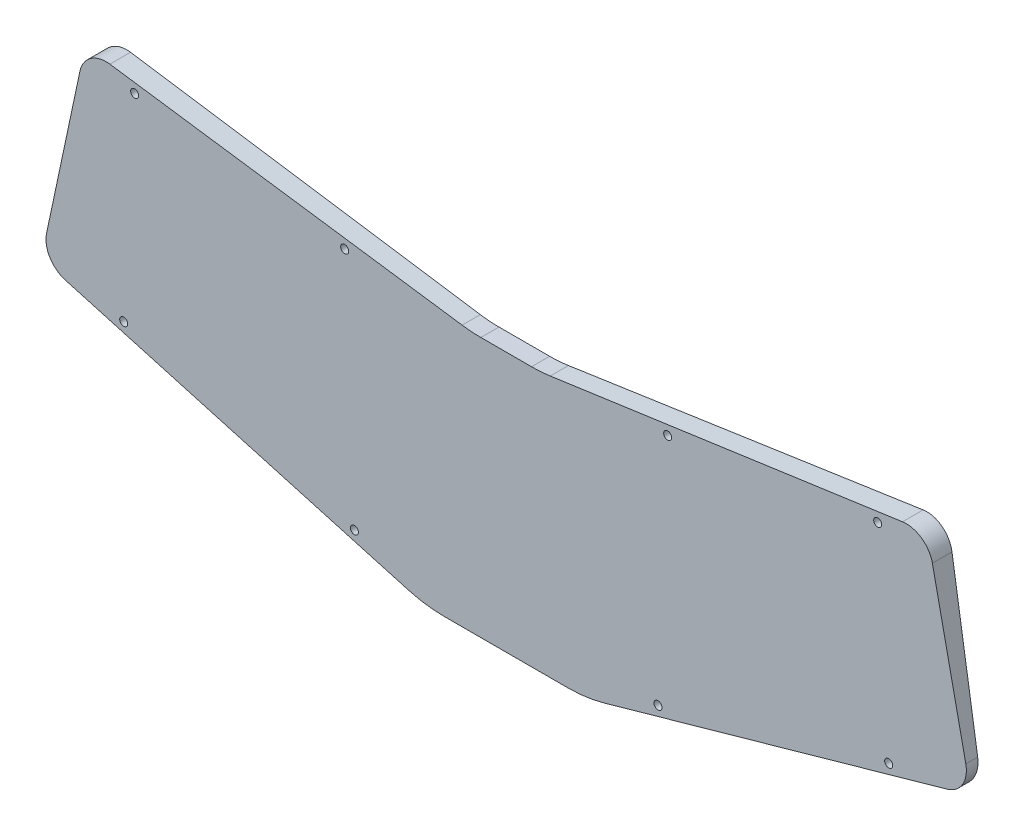
from build123d import *

# Parameters (mm, degrees)
MODEL_R                 = 1.5
BOSS_EXTRUDE1_DEPTH     = 8
MODEL_3_R               = 1.5
BOSS_EXTRUDE2_DEPTH     = 8
CUT_EXTRUDE2_DEPTH      = 341.706541914
CUT_EXTRUDE2_DEPTH_BACK = 341.706541914


with BuildPart() as part:
    # Model → Boss-Extrude1 (new body)
    with BuildSketch(Plane.XY):
        with BuildLine():
            Line((332.060338107, 8.179016053), (319.565261174, 66.96373151))
            ThreePointArc((319.565261174, 66.96373151), (315.515297863, 73.079110459), (308.381777137, 74.78584552))
            Line((308.381777137, 74.78584552), (176.614039179, 56.12761726))
            ThreePointArc((176.614039179, 56.12761726), (173.117705991, 55.75738597), (169.603999044, 55.6337718))
            Line((169.603999044, 55.6337718), (150.648829756, 55.6337718))
            ThreePointArc((150.648829756, 55.6337718), (147.135122809, 55.75738597), (143.63878962, 56.12761726))
            Line((143.63878962, 56.12761726), (11.871051663, 74.785845521))
            ThreePointArc((11.871051663, 74.785845521), (4.737530938, 73.07911046), (0.687567627, 66.963731511))
            Line((0.687567627, 66.963731511), (-11.807509307, 8.179016053))
            ThreePointArc((-11.807509307, 8.179016053), (-10.587273101, 0.932194341), (-4.743504981, -3.523787647))
            Line((-4.743504981, -3.523787647), (123.463014033, -39.725878608))
            ThreePointArc((123.463014033, -39.725878608), (130.191863147, -41.134819356), (137.050372447, -41.6074446))
            Line((137.050372447, -41.6074446), (183.202456353, -41.6074446))
            ThreePointArc((183.202456353, -41.6074446), (190.060965653, -41.134819356), (196.789814767, -39.725878608))
            Line((196.789814767, -39.725878608), (324.996333781, -3.523787647))
            ThreePointArc((324.996333781, -3.523787647), (330.840101901, 0.932194341), (332.060338107, 8.179016053))
        make_face()
        with Locations((103.335575354, -30.405568574)):
            Circle(MODEL_R, mode=Mode.SUBTRACT)
        with Locations((17.039281052, -6.037803815)):
            Circle(MODEL_R, mode=Mode.SUBTRACT)
        with Locations((216.917253446, -30.405568574)):
            Circle(MODEL_R, mode=Mode.SUBTRACT)
        with Locations((303.213547748, -6.037803815)):
            Circle(MODEL_R, mode=Mode.SUBTRACT)
        with Locations((21.146353911, 69.937554571)):
            Circle(MODEL_R, mode=Mode.SUBTRACT)
        with Locations((99.718342652, 58.811810716)):
            Circle(MODEL_R, mode=Mode.SUBTRACT)
        with Locations((220.534486148, 58.811810716)):
            Circle(MODEL_R, mode=Mode.SUBTRACT)
        with Locations((299.10647489, 69.93755457)):
            Circle(MODEL_R, mode=Mode.SUBTRACT)
    extrude(amount=BOSS_EXTRUDE1_DEPTH)

    # Model<3> → Boss-Extrude2 (add)
    with BuildSketch(Plane.XY):
        with BuildLine():
            Line((332.060338107, 8.179016053), (325.312640255, 39.924438699))
            Line((325.312640255, 39.924438699), (319.565261174, 66.96373151))
            ThreePointArc((319.565261174, 66.96373151), (315.515297863, 73.079110459), (308.381777137, 74.78584552))
            Line((308.381777137, 74.78584552), (176.614039179, 56.12761726))
            ThreePointArc((176.614039179, 56.12761726), (173.117705991, 55.75738597), (169.603999044, 55.6337718))
            Line((169.603999044, 55.6337718), (150.648829756, 55.6337718))
            ThreePointArc((150.648829756, 55.6337718), (147.135122809, 55.75738597), (143.63878962, 56.12761726))
            Line((143.63878962, 56.12761726), (11.871051663, 74.785845521))
            ThreePointArc((11.871051663, 74.785845521), (4.737530938, 73.07911046), (0.687567627, 66.963731511))
            Line((0.687567627, 66.963731511), (-5.059811455, 39.924438699))
            Line((-5.059811455, 39.924438699), (-11.807509307, 8.179016053))
            ThreePointArc((-11.807509307, 8.179016053), (-10.587273101, 0.932194341), (-4.743504981, -3.523787647))
            Line((-4.743504981, -3.523787647), (47.488623446, -18.272743308))
            Line((47.488623446, -18.272743308), (123.463014033, -39.725878608))
            ThreePointArc((123.463014033, -39.725878608), (130.191863147, -41.134819356), (137.050372447, -41.6074446))
            Line((137.050372447, -41.6074446), (160.1264144, -41.6074446))
            Line((160.1264144, -41.6074446), (183.202456353, -41.6074446))
            ThreePointArc((183.202456353, -41.6074446), (190.060965653, -41.134819356), (196.789814767, -39.725878608))
            Line((196.789814767, -39.725878608), (272.764205354, -18.272743308))
            Line((272.764205354, -18.272743308), (324.996333781, -3.523787647))
            ThreePointArc((324.996333781, -3.523787647), (330.840101901, 0.932194341), (332.060338107, 8.179016053))
        make_face()
        with Locations((103.335575354, -30.405568574)):
            Circle(MODEL_3_R, mode=Mode.SUBTRACT)
        with Locations((17.039281052, -6.037803815)):
            Circle(MODEL_3_R, mode=Mode.SUBTRACT)
        with Locations((216.917253446, -30.405568574)):
            Circle(MODEL_3_R, mode=Mode.SUBTRACT)
        with Locations((303.213547748, -6.037803815)):
            Circle(MODEL_3_R, mode=Mode.SUBTRACT)
        with Locations((21.146353911, 69.937554571)):
            Circle(MODEL_3_R, mode=Mode.SUBTRACT)
        with Locations((99.718342652, 58.811810716)):
            Circle(MODEL_3_R, mode=Mode.SUBTRACT)
        with BuildLine():
            Line((316.630818371, 66.339996441), (322.378197452, 39.30070363))
            Line((322.378197452, 39.30070363), (329.125895305, 7.555280983))
            ThreePointArc((329.125895305, 7.555280983), (328.27172996, 2.482505785), (324.181092276, -0.636681606))
            Line((324.181092276, -0.636681606), (312.778670176, -3.85642055))
            ThreePointArc((312.778670176, -3.85642055), (308.939676687, -4.169644175), (305.26707195, -3.008629753))
            ThreePointArc((305.26707195, -3.008629753), (302.26243266, -2.669513434), (299.878929754, -4.530096956))
            ThreePointArc((299.878929754, -4.530096956), (297.356002421, -7.440563881), (293.920172489, -9.18155576))
            Line((293.920172489, -9.18155576), (271.948963849, -15.385637267))
            Line((271.948963849, -15.385637267), (226.482375873, -28.224185309))
            ThreePointArc((226.482375873, -28.224185309), (222.643382385, -28.537408934), (218.970777647, -27.376394512))
            ThreePointArc((218.970777647, -27.376394512), (215.966138357, -27.037278193), (213.582635451, -28.897861715))
            ThreePointArc((213.582635451, -28.897861715), (211.059708119, -31.80832864), (207.623878187, -33.549320519))
            Line((207.623878187, -33.549320519), (195.974573262, -36.838772567))
            ThreePointArc((195.974573262, -36.838772567), (189.649455095, -38.16317687), (183.202456353, -38.6074446))
            Line((183.202456353, -38.6074446), (160.1264144, -38.6074446))
            Line((160.1264144, -38.6074446), (137.050372447, -38.6074446))
            ThreePointArc((137.050372447, -38.6074446), (130.603373705, -38.16317687), (124.278255538, -36.838772567))
            Line((124.278255538, -36.838772567), (112.628950613, -33.549320519))
            ThreePointArc((112.628950613, -33.549320519), (109.193120681, -31.80832864), (106.670193349, -28.897861715))
            ThreePointArc((106.670193349, -28.897861715), (104.286690443, -27.037278193), (101.282051153, -27.376394512))
            ThreePointArc((101.282051153, -27.376394512), (97.609446415, -28.537408934), (93.770452927, -28.224185309))
            Line((93.770452927, -28.224185309), (48.303864951, -15.385637267))
            Line((48.303864951, -15.385637267), (26.332656311, -9.18155576))
            ThreePointArc((26.332656311, -9.18155576), (22.896826379, -7.440563881), (20.373899046, -4.530096956))
            ThreePointArc((20.373899046, -4.530096956), (17.99039614, -2.669513434), (14.98575685, -3.008629753))
            ThreePointArc((14.98575685, -3.008629753), (11.313152113, -4.169644175), (7.474158624, -3.85642055))
            Line((7.474158624, -3.85642055), (-3.928263476, -0.636681606))
            ThreePointArc((-3.928263476, -0.636681606), (-8.01890116, 2.482505785), (-8.873066505, 7.555280983))
            Line((-8.873066505, 7.555280983), (-2.125368652, 39.30070363))
            Line((-2.125368652, 39.30070363), (3.622010429, 66.339996442))
            ThreePointArc((3.622010429, 66.339996442), (6.456984747, 70.620761706), (11.450449255, 71.815476249))
            Line((11.450449255, 71.815476249), (13.807051559, 71.481782855))
            ThreePointArc((13.807051559, 71.481782855), (16.05801748, 70.566743382), (17.611829082, 68.698638909))
            ThreePointArc((17.611829082, 68.698638909), (20.250303311, 66.551050421), (23.587647853, 67.21121251))
            ThreePointArc((23.587647853, 67.21121251), (27.071325394, 68.854371308), (30.917639732, 69.058934404))
            Line((30.917639732, 69.058934404), (90.087257633, 60.680553975))
            ThreePointArc((90.087257633, 60.680553975), (93.725570339, 59.416172428), (96.616102068, 56.870429634))
            ThreePointArc((96.616102068, 56.870429634), (99.227639842, 55.346379898), (102.159636594, 56.085468655))
            ThreePointArc((102.159636594, 56.085468655), (105.643314135, 57.728627453), (109.489628473, 57.933190549))
            Line((109.489628473, 57.933190549), (143.218187212, 53.157247988))
            ThreePointArc((143.218187212, 53.157247988), (146.924300392, 52.76480282), (150.648829756, 52.6337718))
            Line((150.648829756, 52.6337718), (169.603999044, 52.6337718))
            ThreePointArc((169.603999044, 52.6337718), (173.328528408, 52.76480282), (177.034641588, 53.157247988))
            Line((177.034641588, 53.157247988), (210.763200327, 57.933190549))
            ThreePointArc((210.763200327, 57.933190549), (214.609514665, 57.728627453), (218.093192206, 56.085468655))
            ThreePointArc((218.093192206, 56.085468655), (221.025188958, 55.346379898), (223.636726732, 56.870429634))
            ThreePointArc((223.636726732, 56.870429634), (226.52725846, 59.416172428), (230.165571167, 60.680553974))
            Line((230.165571167, 60.680553974), (289.335189068, 69.058934403))
            ThreePointArc((289.335189068, 69.058934403), (293.181503406, 68.854371307), (296.665180948, 67.211212509))
            ThreePointArc((296.665180948, 67.211212509), (300.002525489, 66.55105042), (302.640999718, 68.698638908))
            ThreePointArc((302.640999718, 68.698638908), (304.19481132, 70.566743381), (306.445777241, 71.481782853))
            Line((306.445777241, 71.481782853), (308.802379545, 71.815476247))
            ThreePointArc((308.802379545, 71.815476247), (313.795844053, 70.620761705), (316.630818371, 66.339996441))
        make_face(mode=Mode.SUBTRACT)
        with Locations((220.534486148, 58.811810716)):
            Circle(MODEL_3_R, mode=Mode.SUBTRACT)
        with Locations((299.10647489, 69.93755457)):
            Circle(MODEL_3_R, mode=Mode.SUBTRACT)
    extrude(amount=BOSS_EXTRUDE2_DEPTH)

    # Sketch2 → Cut-Extrude2 (cut, two sides: drawn at the far end of the back side and taken through both)
    with BuildSketch(Plane(origin=(0, 0, 0), x_dir=(0, 0, -1), z_dir=(1, 0, 0)).offset(-CUT_EXTRUDE2_DEPTH_BACK)):
        Polygon((0, -41.6074446), (0, 80.521148268), (-6, -41.6074446), align=None)
    extrude(amount=CUT_EXTRUDE2_DEPTH + CUT_EXTRUDE2_DEPTH_BACK, mode=Mode.SUBTRACT)


solid = part.part
